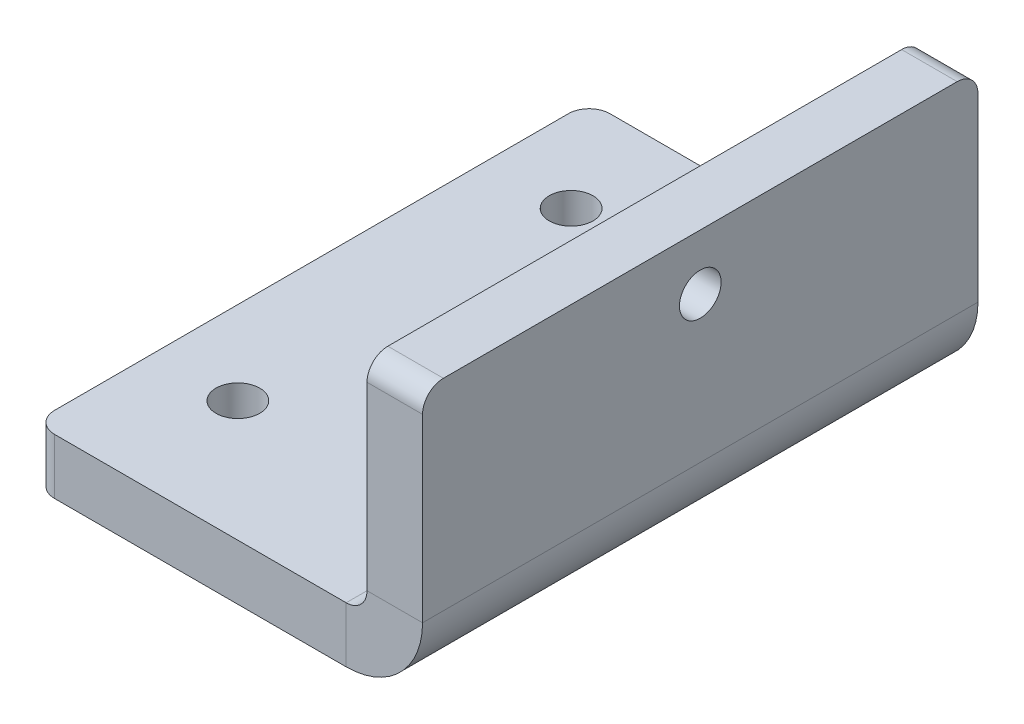
from build123d import *

# Parameters (mm, degrees)
BASE_FLANGE1_DEPTH = 40
FILLET1_R          = 3
SKETCH6_R          = 3.15
CUT_EXTRUDE1_DEPTH = 10
SKETCH7_R          = 3
CUT_EXTRUDE2_DEPTH = 10


# Sheet-metal steps are written as plain solids
with BuildPart() as part:
    # Sketch1 → Base-Flange1 (new, symmetric)
    with BuildSketch(Plane.XY):
        with BuildLine():
            Line((-48, 0), (-3, 0))
            ThreePointArc((-3, 0), (-0.878679656, 0.878679656), (0, 3))
            Line((0, 3), (0, 32))
            Line((0, 32), (8, 32))
            Line((8, 32), (8, 3))
            ThreePointArc((8, 3), (4.778174593, -4.778174593), (-3, -8))
            Line((-3, -8), (-48, -8))
            Line((-48, -8), (-48, 0))
        make_face()
    extrude(amount=BASE_FLANGE1_DEPTH, both=True)

    # Fillet1
    fillet1_edges = [part.edges().sort_by_distance(p)[0] for p in [
        (-48, -4, 40),
        (-48, -4, -40),
        (4, 32, 40),
        (4, 32, -40),
    ]]
    fillet(fillet1_edges, radius=FILLET1_R)

    # Sketch6 → Cut-Extrude1 (cut)
    with BuildSketch(Plane(origin=(0, 0, 0), x_dir=(1, 0, 0), z_dir=(0, 1, 0))):
        with Locations(Location((-36, 25.397681591, 0), (0, 0, 270))):
            Circle(SKETCH6_R)
        with Locations(Location((-36, -22.602318409, 0), (0, 0, 270))):
            Circle(SKETCH6_R)
    extrude(amount=-CUT_EXTRUDE1_DEPTH, mode=Mode.SUBTRACT)

    # Sketch7 → Cut-Extrude2 (cut)
    with BuildSketch(Plane.ZY):
        with Locations((0, 24)):
            Circle(SKETCH7_R)
    extrude(amount=-CUT_EXTRUDE2_DEPTH, mode=Mode.SUBTRACT)


solid = part.part
